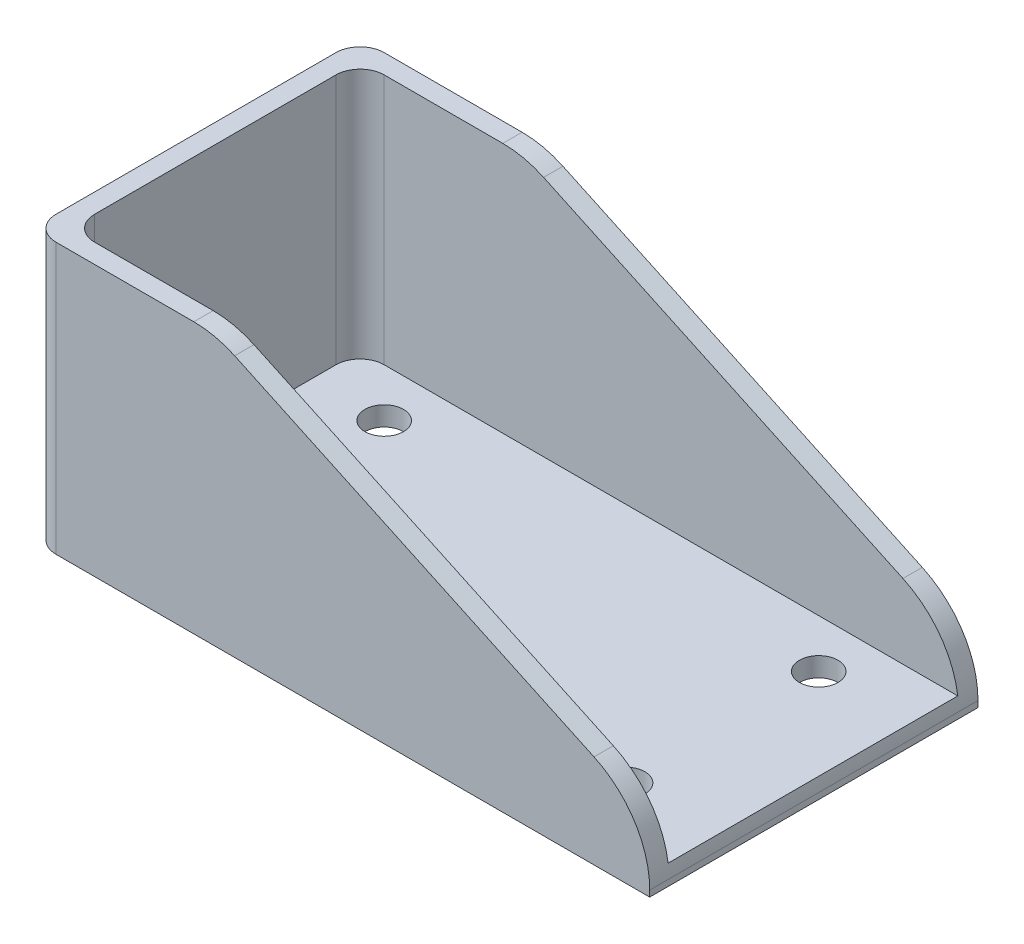
from build123d import *

# Parameters (mm, degrees)
SKETCH_1_W               = 64
SKETCH_1_H               = 34
SKETCH_1_W_2             = 60
SKETCH_1_H_2             = 30
EXTRUDE_1_DEPTH          = 28
SKETCH_1_2_W             = 60
SKETCH_1_2_H             = 30
EXTRUDE_1_2_DEPTH        = 2
FILLET_3_R               = 2.5
CUT_EXTRUDE_6_DEPTH      = 55.442630355
CUT_EXTRUDE_6_DEPTH_BACK = 55.442630355
FILLET_4_R               = 10
SKETCH_8_W               = 30
SKETCH_8_H               = 4.631369762
CUT_EXTRUDE_7_DEPTH      = 71.121323433
CUT_EXTRUDE_9_DEPTH      = 45.598206242
CUT_EXTRUDE_9_DEPTH_BACK = 45.598206242
SKETCH_9_R               = 2


with BuildPart() as part:
    # Эскиз1 → Extrude 1 (new body)
    with BuildSketch(Plane(origin=(0, 0, 0), x_dir=(1, 0, 0), z_dir=(0, 1, 0))):
        Rectangle(SKETCH_1_W, SKETCH_1_H)
        Rectangle(SKETCH_1_W_2, SKETCH_1_H_2, mode=Mode.SUBTRACT)
    extrude(amount=EXTRUDE_1_DEPTH)

    # Эскиз1<2> → Extrude 1 2 (add)
    with BuildSketch(Plane(origin=(0, 0, 0), x_dir=(1, 0, 0), z_dir=(0, 1, 0))):
        Rectangle(SKETCH_1_2_W, SKETCH_1_2_H)
    extrude(amount=EXTRUDE_1_2_DEPTH)

    # Скругление3
    fillet_3_edges = [part.edges().sort_by_distance(p)[0] for p in [
        (-30, 15, -15),
        (-30, 15, 15),
        (-32, 14, -17),
        (-32, 14, 17),
    ]]
    fillet(fillet_3_edges, radius=FILLET_3_R)

    # Эскиз3 → Вырез-Вытянуть6 (cut, two sides: drawn at the far end of the back side and taken through both)
    with BuildSketch(Plane.XY.offset(17).offset(-CUT_EXTRUDE_6_DEPTH_BACK)):
        Polygon((-13, 28), (32, 7), (32, 28), align=None)
    extrude(amount=CUT_EXTRUDE_6_DEPTH + CUT_EXTRUDE_6_DEPTH_BACK, mode=Mode.SUBTRACT)

    # Скругление4
    # the kernel refuses this fillet: 10 mm, written as the material it takes off along each edge
    with BuildSketch(Plane(origin=(32, 7, -32.921575595), x_dir=(0, -1, 0), z_dir=(0, 0, 1))) as fillet_4_piece_1:
        with BuildLine():
            CenterArc((FILLET_4_R * 0.636863023816, -FILLET_4_R), FILLET_4_R, 90, 64.983106522)
            Line((-FILLET_4_R * 0.269320116179, -FILLET_4_R * 0.577114534669), (0, 0))
            Line((0, 0), (FILLET_4_R * 0.636863023816, 0))
        make_face()
    extrude(amount=65.843151191, mode=Mode.SUBTRACT)
    with BuildSketch(Plane(origin=(-13, 28, 22.546233419), x_dir=(0.9061831399952657, -0.4228854653311234, 0), z_dir=(0, 0, -1)), Plane(origin=(-13, 28, -9.453766581), x_dir=(0.9061831399952657, -0.4228854653311234, 0), z_dir=(0, 0, -1))) as fillet_4_piece_2:
        with BuildLine():
            CenterArc((FILLET_4_R * 0.22184933675, FILLET_4_R), FILLET_4_R, 244.983106522, 25.016893478)
            Line((-FILLET_4_R * 0.201036128582, FILLET_4_R * 0.0938168600047), (0, 0))
            Line((0, 0), (FILLET_4_R * 0.22184933675, 0))
        make_face()
    extrude(amount=13.092466837, mode=Mode.SUBTRACT)

    # Эскиз8 → Вырез-Вытянуть7 (cut, through all)
    with BuildSketch(Plane.ZY.offset(-30)):
        with Locations((0, 4.315684881)):
            Rectangle(SKETCH_8_W, SKETCH_8_H)
    extrude(amount=-CUT_EXTRUDE_7_DEPTH, mode=Mode.SUBTRACT)

    # Эскиз9 → Вырез-Вытянуть9 (cut, two sides: drawn at the far end of the back side and taken through both)
    with BuildSketch(Plane(origin=(0, 2, 0), x_dir=(1, 0, 0), z_dir=(0, 1, 0)).offset(-CUT_EXTRUDE_9_DEPTH_BACK)):
        with Locations(Location((-22.5, -10, 0), (0, 0, 270))):
            Circle(SKETCH_9_R)
        with Locations(Location((-22.5, 10, 0), (0, 0, 270))):
            Circle(SKETCH_9_R)
        with Locations(Location((22.5, 10, 0), (0, 0, 270))):
            Circle(SKETCH_9_R)
        with Locations(Location((22.5, -10, 0), (0, 0, 270))):
            Circle(SKETCH_9_R)
    extrude(amount=CUT_EXTRUDE_9_DEPTH + CUT_EXTRUDE_9_DEPTH_BACK, mode=Mode.SUBTRACT)


solid = part.part
